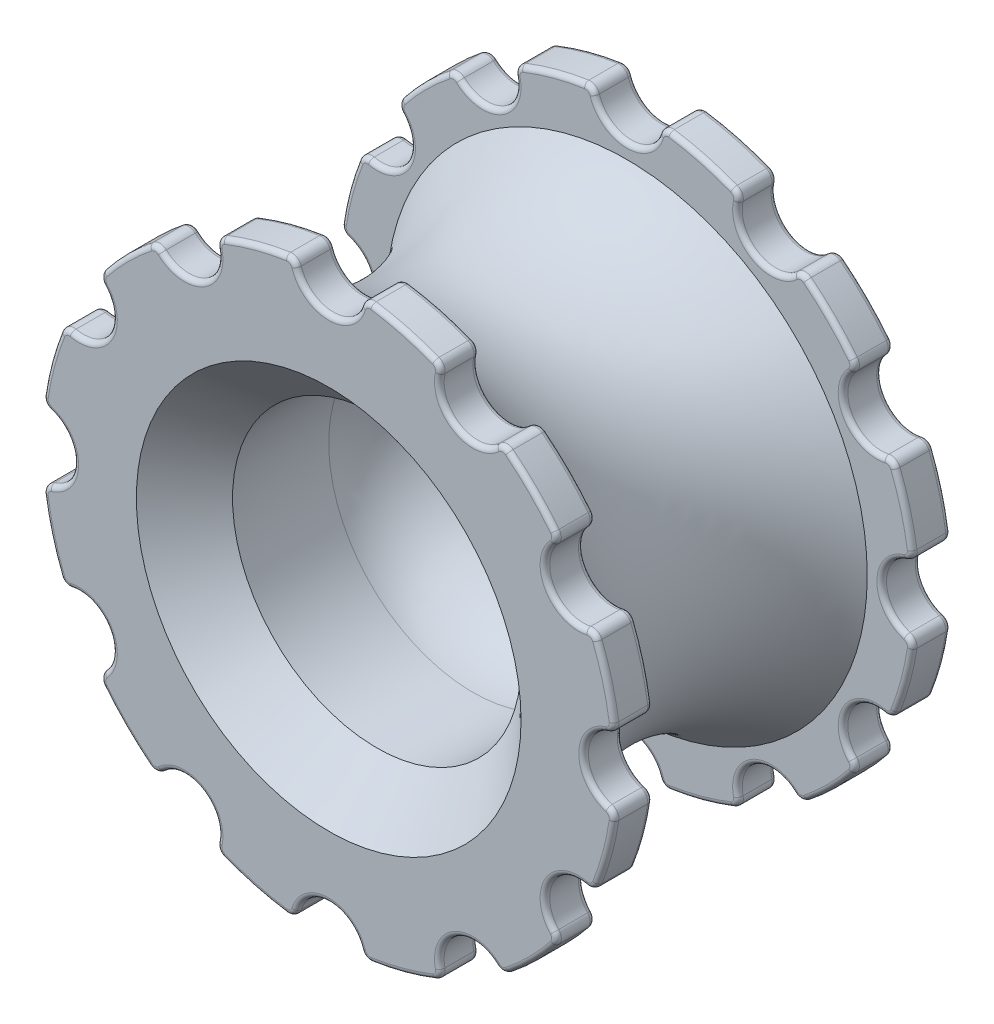
from build123d import *

# Parameters (mm, degrees)
EXTRUDE_1_DEPTH     = 35
FILLET_1_R          = 1
SKETCH_3_R          = 15
CUT_EXTRUDE_1_DEPTH = 25
FILLET_2_R          = 0.5
FILLET_3_R          = 10
CHAMFER_1_SIZE      = 5
SKETCH_4_R          = 6
EXTRUDE_2_DEPTH     = 1
SKETCH_5_R          = 3.75
EXTRUDE_3_DEPTH     = 3.5
SKETCH_6_R          = 2.7
CUT_EXTRUDE_2_DEPTH = 1
CUT_EXTRUDE_3_DEPTH = 8
SKETCH_8_R          = 1.475
CUT_EXTRUDE_4_DEPTH = 17


with BuildPart() as part:
    # Эскиз1 → Бобышка-Вытянуть1 (new body)
    with BuildSketch(Plane.XY):
        with BuildLine():
            ThreePointArc((-3.494040064, 29.795833333), (0, 26.5), (3.494040064, 29.795833333))
            ThreePointArc((3.494040064, 29.795833333), (7.764571353, 28.977774789), (11.871989209, 27.550968626))
            ThreePointArc((11.871989209, 27.550968626), (13.25, 22.9496732), (17.923844124, 24.056928561))
            ThreePointArc((17.923844124, 24.056928561), (21.213203436, 21.213203436), (24.056928561, 17.923844124))
            ThreePointArc((24.056928561, 17.923844124), (22.9496732, 13.25), (27.550968626, 11.871989209))
            ThreePointArc((27.550968626, 11.871989209), (28.977774789, 7.764571353), (29.795833333, 3.494040064))
            ThreePointArc((29.795833333, 3.494040064), (26.5, 0), (29.795833333, -3.494040064))
            ThreePointArc((29.795833333, -3.494040064), (28.977774789, -7.764571353), (27.550968626, -11.871989209))
            ThreePointArc((27.550968626, -11.871989209), (22.9496732, -13.25), (24.056928561, -17.923844124))
            ThreePointArc((24.056928561, -17.923844124), (21.213203436, -21.213203436), (17.923844124, -24.056928561))
            ThreePointArc((17.923844124, -24.056928561), (13.25, -22.9496732), (11.871989209, -27.550968626))
            ThreePointArc((11.871989209, -27.550968626), (7.764571353, -28.977774789), (3.494040064, -29.795833333))
            ThreePointArc((3.494040064, -29.795833333), (0, -26.5), (-3.494040064, -29.795833333))
            ThreePointArc((-3.494040064, -29.795833333), (-7.764571353, -28.977774789), (-11.871989209, -27.550968626))
            ThreePointArc((-11.871989209, -27.550968626), (-13.25, -22.9496732), (-17.923844124, -24.056928561))
            ThreePointArc((-17.923844124, -24.056928561), (-21.213203436, -21.213203436), (-24.056928561, -17.923844124))
            ThreePointArc((-24.056928561, -17.923844124), (-22.9496732, -13.25), (-27.550968626, -11.871989209))
            ThreePointArc((-27.550968626, -11.871989209), (-28.977774789, -7.764571353), (-29.795833333, -3.494040064))
            ThreePointArc((-29.795833333, -3.494040064), (-26.5, 0), (-29.795833333, 3.494040064))
            ThreePointArc((-29.795833333, 3.494040064), (-28.977774789, 7.764571353), (-27.550968626, 11.871989209))
            ThreePointArc((-27.550968626, 11.871989209), (-22.9496732, 13.25), (-24.056928561, 17.923844124))
            ThreePointArc((-24.056928561, 17.923844124), (-21.213203436, 21.213203436), (-17.923844124, 24.056928561))
            ThreePointArc((-17.923844124, 24.056928561), (-13.25, 22.9496732), (-11.871989209, 27.550968626))
            ThreePointArc((-11.871989209, 27.550968626), (-7.764571353, 28.977774789), (-3.494040064, 29.795833333))
        make_face()
    extrude(amount=EXTRUDE_1_DEPTH)

    # Скругление1
    fillet_1_edges = [part.edges().sort_by_distance(p)[0] for p in [
        (3.494040064, 29.795833333, 17.5),
        (11.871989209, 27.550968626, 17.5),
        (17.923844124, 24.056928561, 17.5),
        (29.795833333, 3.494040064, 17.5),
        (27.550968626, 11.871989209, 17.5),
        (24.056928561, 17.923844124, 17.5),
        (29.795833333, -3.494040064, 17.5),
        (27.550968626, -11.871989209, 17.5),
        (17.923844124, -24.056928561, 17.5),
        (24.056928561, -17.923844124, 17.5),
        (11.871989209, -27.550968626, 17.5),
        (-11.871989209, -27.550968626, 17.5),
        (3.494040064, -29.795833333, 17.5),
        (-3.494040064, -29.795833333, 17.5),
        (-17.923844124, -24.056928561, 17.5),
        (-24.056928561, -17.923844124, 17.5),
        (-27.550968626, -11.871989209, 17.5),
        (-29.795833333, -3.494040064, 17.5),
        (-29.795833333, 3.494040064, 17.5),
        (-27.550968626, 11.871989209, 17.5),
        (-24.056928561, 17.923844124, 17.5),
        (-17.923844124, 24.056928561, 17.5),
        (-11.871989209, 27.550968626, 17.5),
        (-3.494040064, 29.795833333, 17.5),
    ]]
    fillet(fillet_1_edges, radius=FILLET_1_R)

    # Эскиз2 → Вырез-Повернуть1 (revolve, cut)
    with BuildSketch(Plane(origin=(0, 0, 0), x_dir=(1, 0, 0), z_dir=(0, 1, 0))):
        with BuildLine():
            Line((-30, -4), (-30, -31))
            Line((-30, -31), (-25, -31))
            ThreePointArc((-25, -31), (-19.756354563, -17.5), (-25, -4))
            Line((-25, -4), (-30, -4))
        make_face()
    revolve(axis=Axis((0, 0, 1000), (0, 0, -1)), mode=Mode.SUBTRACT)

    # Эскиз3 → Вырез-Вытянуть1 (cut)
    with BuildSketch(Plane.XY.offset(35)):
        Circle(SKETCH_3_R)
    extrude(amount=-CUT_EXTRUDE_1_DEPTH, mode=Mode.SUBTRACT)

    # Скругление2
    fillet_2_edges = [part.edges().sort_by_distance(p)[0] for p in [
        (-29.525356682, -3.768908965, 4),
        (-26.5, 0, 4),
        (-29.525356682, 3.768908965, 4),
        (-28.977774789, 7.764571353, 4),
        (-27.454163425, 11.498707433, 4),
        (-22.9496732, 13.25, 4),
        (-23.68525446, 18.02664925, 4),
        (-21.213203436, 21.213203436, 4),
        (-18.02664925, 23.68525446, 4),
        (-13.25, 22.9496732, 4),
        (-11.498707433, 27.454163425, 4),
        (-7.764571353, 28.977774789, 4),
        (-3.768908965, 29.525356682, 4),
        (0, 26.5, 4),
        (3.768908965, 29.525356682, 4),
        (7.764571353, 28.977774789, 4),
        (11.498707433, 27.454163425, 4),
        (13.25, 22.9496732, 4),
        (18.02664925, 23.68525446, 4),
        (21.213203436, 21.213203436, 4),
        (23.68525446, 18.02664925, 4),
        (22.9496732, 13.25, 4),
        (27.454163425, 11.498707433, 4),
        (28.977774789, 7.764571353, 4),
        (29.525356682, 3.768908965, 4),
        (26.5, 0, 4),
        (29.525356682, -3.768908965, 4),
        (28.977774789, -7.764571353, 4),
        (27.454163425, -11.498707433, 4),
        (22.9496732, -13.25, 4),
        (23.68525446, -18.02664925, 4),
        (21.213203436, -21.213203436, 4),
        (18.02664925, -23.68525446, 4),
        (13.25, -22.9496732, 4),
        (11.498707433, -27.454163425, 4),
        (7.764571353, -28.977774789, 4),
        (3.768908965, -29.525356682, 4),
        (0, -26.5, 4),
        (-3.768908965, -29.525356682, 4),
        (-7.764571353, -28.977774789, 4),
        (-11.498707433, -27.454163425, 4),
        (-13.25, -22.9496732, 4),
        (-18.02664925, -23.68525446, 4),
        (-21.213203436, -21.213203436, 4),
        (-23.68525446, -18.02664925, 4),
        (-22.9496732, -13.25, 4),
        (-27.454163425, -11.498707433, 4),
        (-29.525356682, -3.768908965, 31),
        (-26.5, 0, 31),
        (-29.525356682, 3.768908965, 31),
        (-28.977774789, 7.764571353, 31),
        (-27.454163425, 11.498707433, 31),
        (-22.9496732, 13.25, 31),
        (-23.68525446, 18.02664925, 31),
        (-21.213203436, 21.213203436, 31),
        (-18.02664925, 23.68525446, 31),
        (-13.25, 22.9496732, 31),
        (-11.498707433, 27.454163425, 31),
        (-7.764571353, 28.977774789, 31),
        (-3.768908965, 29.525356682, 31),
        (0, 26.5, 31),
        (3.768908965, 29.525356682, 31),
        (7.764571353, 28.977774789, 31),
        (11.498707433, 27.454163425, 31),
        (13.25, 22.9496732, 31),
        (18.02664925, 23.68525446, 31),
        (21.213203436, 21.213203436, 31),
        (23.68525446, 18.02664925, 31),
        (22.9496732, 13.25, 31),
        (27.454163425, 11.498707433, 31),
        (28.977774789, 7.764571353, 31),
        (29.525356682, 3.768908965, 31),
        (26.5, 0, 31),
        (29.525356682, -3.768908965, 31),
        (28.977774789, -7.764571353, 31),
        (27.454163425, -11.498707433, 31),
        (22.9496732, -13.25, 31),
        (23.68525446, -18.02664925, 31),
        (21.213203436, -21.213203436, 31),
        (18.02664925, -23.68525446, 31),
        (13.25, -22.9496732, 31),
        (11.498707433, -27.454163425, 31),
        (7.764571353, -28.977774789, 31),
        (3.768908965, -29.525356682, 31),
        (0, -26.5, 31),
        (-3.768908965, -29.525356682, 31),
        (-7.764571353, -28.977774789, 31),
        (-11.498707433, -27.454163425, 31),
        (-13.25, -22.9496732, 31),
        (-18.02664925, -23.68525446, 31),
        (-21.213203436, -21.213203436, 31),
        (-23.68525446, -18.02664925, 31),
        (-22.9496732, -13.25, 31),
        (-27.454163425, -11.498707433, 31),
        (-29.525356682, 3.768908965, 35),
        (-28.977774789, 7.764571353, 35),
        (-27.454163425, 11.498707433, 35),
        (-22.9496732, 13.25, 35),
        (-23.68525446, 18.02664925, 35),
        (-21.213203436, 21.213203436, 35),
        (-18.02664925, 23.68525446, 35),
        (-13.25, 22.9496732, 35),
        (-11.498707433, 27.454163425, 35),
        (-7.764571353, 28.977774789, 35),
        (-3.768908965, 29.525356682, 35),
        (0, 26.5, 35),
        (3.768908965, 29.525356682, 35),
        (7.764571353, 28.977774789, 35),
        (11.498707433, 27.454163425, 35),
        (13.25, 22.9496732, 35),
        (18.02664925, 23.68525446, 35),
        (21.213203436, 21.213203436, 35),
        (23.68525446, 18.02664925, 35),
        (22.9496732, 13.25, 35),
        (27.454163425, 11.498707433, 35),
        (28.977774789, 7.764571353, 35),
        (29.525356682, 3.768908965, 35),
        (26.5, 0, 35),
        (29.525356682, -3.768908965, 35),
        (28.977774789, -7.764571353, 35),
        (27.454163425, -11.498707433, 35),
        (22.9496732, -13.25, 35),
        (23.68525446, -18.02664925, 35),
        (21.213203436, -21.213203436, 35),
        (18.02664925, -23.68525446, 35),
        (13.25, -22.9496732, 35),
        (11.498707433, -27.454163425, 35),
        (7.764571353, -28.977774789, 35),
        (3.768908965, -29.525356682, 35),
        (0, -26.5, 35),
        (-3.768908965, -29.525356682, 35),
        (-7.764571353, -28.977774789, 35),
        (-11.498707433, -27.454163425, 35),
        (-13.25, -22.9496732, 35),
        (-18.02664925, -23.68525446, 35),
        (-21.213203436, -21.213203436, 35),
        (-23.68525446, -18.02664925, 35),
        (-22.9496732, -13.25, 35),
        (-27.454163425, -11.498707433, 35),
        (-28.977774789, -7.764571353, 35),
        (-29.525356682, -3.768908965, 35),
        (3.768908965, 29.525356682, 0),
        (0, 26.5, 0),
        (-3.768908965, 29.525356682, 0),
        (-7.764571353, 28.977774789, 0),
        (-11.498707433, 27.454163425, 0),
        (-13.25, 22.9496732, 0),
        (-18.02664925, 23.68525446, 0),
        (-21.213203436, 21.213203436, 0),
        (-23.68525446, 18.02664925, 0),
        (-22.9496732, 13.25, 0),
        (-27.454163425, 11.498707433, 0),
        (-28.977774789, 7.764571353, 0),
        (-29.525356682, 3.768908965, 0),
        (-26.5, 0, 0),
        (-29.525356682, -3.768908965, 0),
        (-28.977774789, -7.764571353, 0),
        (-27.454163425, -11.498707433, 0),
        (-22.9496732, -13.25, 0),
        (-23.68525446, -18.02664925, 0),
        (-21.213203436, -21.213203436, 0),
        (-18.02664925, -23.68525446, 0),
        (-13.25, -22.9496732, 0),
        (-11.498707433, -27.454163425, 0),
        (-7.764571353, -28.977774789, 0),
        (-3.768908965, -29.525356682, 0),
        (0, -26.5, 0),
        (3.768908965, -29.525356682, 0),
        (7.764571353, -28.977774789, 0),
        (11.498707433, -27.454163425, 0),
        (13.25, -22.9496732, 0),
        (18.02664925, -23.68525446, 0),
        (21.213203436, -21.213203436, 0),
        (23.68525446, -18.02664925, 0),
        (22.9496732, -13.25, 0),
        (27.454163425, -11.498707433, 0),
        (28.977774789, -7.764571353, 0),
        (29.525356682, -3.768908965, 0),
        (26.5, 0, 0),
        (29.525356682, 3.768908965, 0),
        (28.977774789, 7.764571353, 0),
        (27.454163425, 11.498707433, 0),
        (22.9496732, 13.25, 0),
        (23.68525446, 18.02664925, 0),
        (21.213203436, 21.213203436, 0),
        (18.02664925, 23.68525446, 0),
        (13.25, 22.9496732, 0),
        (11.498707433, 27.454163425, 0),
        (7.764571353, 28.977774789, 0),
        (-28.977774789, -7.764571353, 4),
        (-28.977774789, -7.764571353, 31),
        (-26.5, 0, 35),
    ]]
    fillet(fillet_2_edges, radius=FILLET_2_R)

    # Скругление3
    fillet_3_edges = [part.edges().sort_by_distance(p)[0] for p in [
        (-15, 0, 10),
    ]]
    fillet(fillet_3_edges, radius=FILLET_3_R)

    # Фаска1
    chamfer_1_edges = [part.edges().sort_by_distance(p)[0] for p in [
        (-15, 0, 35),
    ]]
    chamfer(chamfer_1_edges, length=CHAMFER_1_SIZE)

    # Эскиз4 → Бобышка-Вытянуть2 (add)
    with BuildSketch(Plane(origin=(0, 0, 0), x_dir=(-1, 0, 0), z_dir=(0, 0, -1))):
        Circle(SKETCH_4_R)
    extrude(amount=EXTRUDE_2_DEPTH)

    # Эскиз5 → Бобышка-Вытянуть3 (add)
    with BuildSketch(Plane(origin=(0, 0, -1), x_dir=(-1, 0, 0), z_dir=(0, 0, -1))):
        Circle(SKETCH_5_R)
    extrude(amount=EXTRUDE_3_DEPTH)

    # Эскиз6 → Вырез-Вытянуть2 (cut)
    with BuildSketch(Plane(origin=(0, 0, -4.5), x_dir=(-1, 0, 0), z_dir=(0, 0, -1))):
        Circle(SKETCH_6_R)
    extrude(amount=-CUT_EXTRUDE_2_DEPTH, mode=Mode.SUBTRACT)

    # Эскиз7 → Вырез-Вытянуть3 (cut)
    with BuildSketch(Plane(origin=(0, 0, -3.5), x_dir=(-1, 0, 0), z_dir=(0, 0, -1))):
        with BuildLine():
            Line((-1.85, 1.966596044), (-1.85, -1.966596044))
            ThreePointArc((-1.85, -1.966596044), (0, -2.7), (1.85, -1.966596044))
            Line((1.85, -1.966596044), (1.85, 1.966596044))
            ThreePointArc((1.85, 1.966596044), (0, 2.7), (-1.85, 1.966596044))
        make_face()
    extrude(amount=-CUT_EXTRUDE_3_DEPTH, mode=Mode.SUBTRACT)

    # Эскиз8 → Вырез-Вытянуть4 (cut)
    with BuildSketch(Plane.XY.offset(10)):
        Circle(SKETCH_8_R)
    extrude(amount=-CUT_EXTRUDE_4_DEPTH, mode=Mode.SUBTRACT)


solid = part.part
